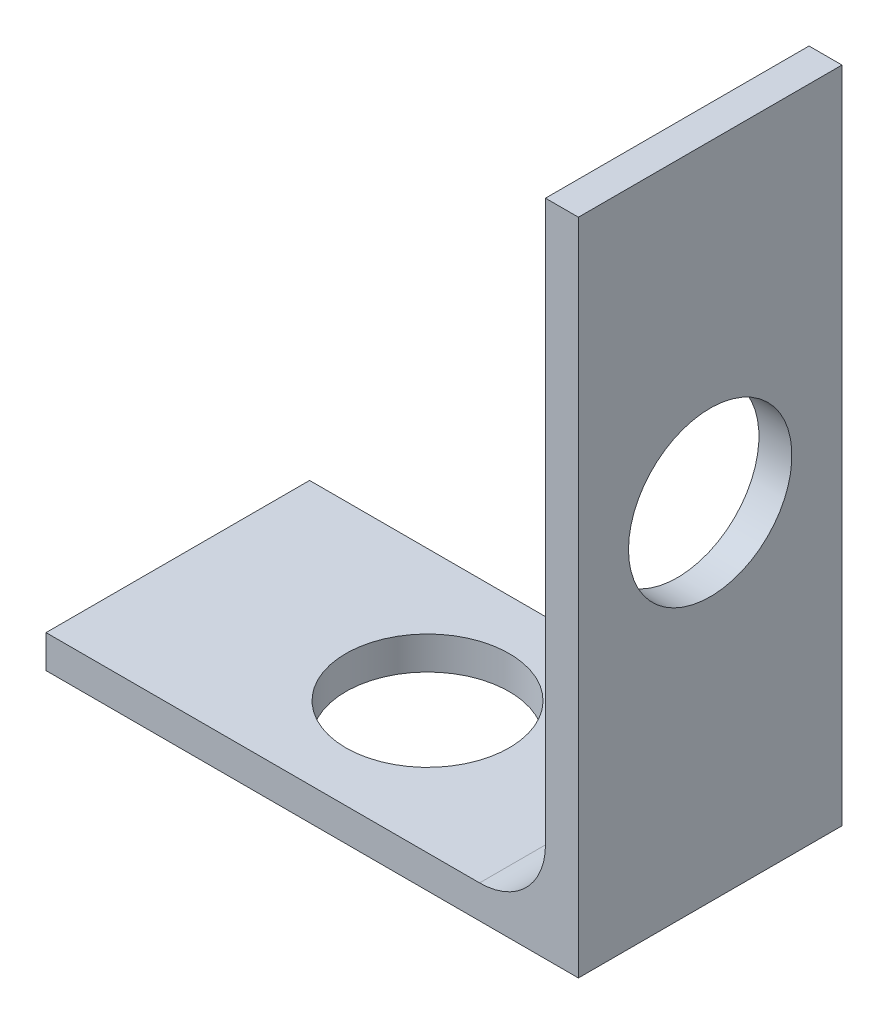
from build123d import *

# Parameters (mm, degrees)
BOSS_EXTRUDE1_DEPTH = 12.7
SKETCH2_R           = 3.937
CUT_EXTRUDE1_DEPTH  = 6.35
SKETCH4_R           = 3.937
CUT_EXTRUDE2_DEPTH  = 6.35
FILLET2_R           = 3.175


with BuildPart() as part:
    # Sketch1 → Boss-Extrude1 (new body)
    with BuildSketch(Plane.XY):
        Polygon((0, 0), (25.654, 0), (25.654, 31.75), (24.0665, 31.75), (24.0665, 1.5875), (0, 1.5875), align=None)
    extrude(amount=BOSS_EXTRUDE1_DEPTH)

    # Sketch2 → Cut-Extrude1 (cut)
    with BuildSketch(Plane.ZY.offset(-24.0665)):
        with Locations((6.35, 16.66875)):
            Circle(SKETCH2_R)
    extrude(amount=-CUT_EXTRUDE1_DEPTH, mode=Mode.SUBTRACT)

    # Sketch4 → Cut-Extrude2 (cut)
    with BuildSketch(Plane(origin=(0, 1.5875, 0), x_dir=(1, 0, 0), z_dir=(0, 1, 0))):
        with Locations((12.03325, -6.35)):
            Circle(SKETCH4_R)
    extrude(amount=-CUT_EXTRUDE2_DEPTH, mode=Mode.SUBTRACT)

    # Fillet2
    fillet2_edges = [part.edges().sort_by_distance(p)[0] for p in [
        (24.0665, 1.5875, 6.35),
    ]]
    fillet(fillet2_edges, radius=FILLET2_R)


solid = part.part
